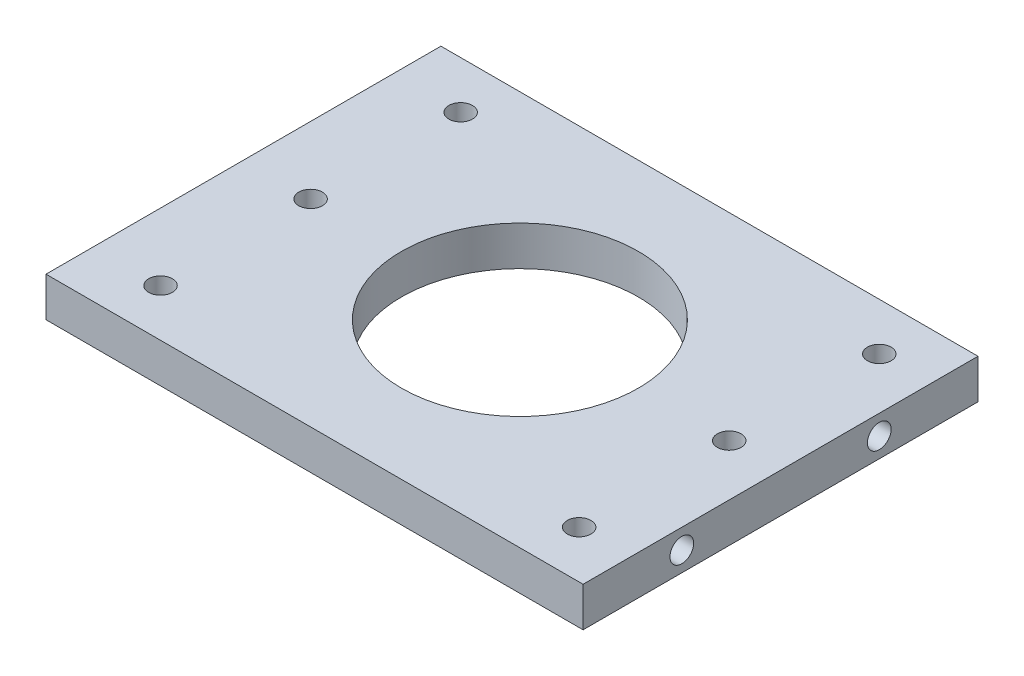
from build123d import *

# Parameters (mm, degrees)
ESQUISSE1_W             = 68
ESQUISSE1_H             = 5
BOSS_EXTRU_1_DEPTH      = 50
ESQUISSE2_R             = 15
ESQUISSE2_R_2           = 1.5
ENL_V_MAT_EXTRU_1_DEPTH = 73.672209269
ESQUISSE3_R             = 1.5
ENL_V_MAT_EXTRU_2_DEPTH = 10
ENL_V_START             = -10
ESQUISSE4_R             = 1.5
ENL_V_MAT_EXTRU_3_DEPTH = 10


with BuildPart() as part:
    # Esquisse1 → Boss.-Extru.1 (new body)
    with BuildSketch(Plane.XY):
        with Locations((18.5, -47.5)):
            Rectangle(ESQUISSE1_W, ESQUISSE1_H)
    extrude(amount=BOSS_EXTRU_1_DEPTH)

    # Esquisse2 → Enlèv. mat.-Extru.1 (cut, through all)
    with BuildSketch(Plane(origin=(0, -45, 0), x_dir=(-1, 0, 0), z_dir=(0, 1, 0))):
        with Locations((-19.5, 25)):
            Circle(ESQUISSE2_R)
        with Locations((-46, 44)):
            Circle(ESQUISSE2_R_2)
        with Locations((-46, 6)):
            Circle(ESQUISSE2_R_2)
        with Locations((7, 44)):
            Circle(ESQUISSE2_R_2)
        with Locations((7, 6)):
            Circle(ESQUISSE2_R_2)
        with Locations((7, 25)):
            Circle(ESQUISSE2_R_2)
        with Locations((-46, 25)):
            Circle(ESQUISSE2_R_2)
    extrude(amount=-ENL_V_MAT_EXTRU_1_DEPTH, mode=Mode.SUBTRACT)

    # Esquisse3 → Enlèv. mat.-Extru.2 (cut)
    with BuildSketch(Plane.ZY.offset(15.5)):
        with Locations((12.5, -47.5)):
            Circle(ESQUISSE3_R)
        with Locations((37.5, -47.5)):
            Circle(ESQUISSE3_R)
    extrude(amount=-ENL_V_MAT_EXTRU_2_DEPTH, mode=Mode.SUBTRACT)

    # Esquisse4 → Enlèv. mat.-Extru.3 (cut)
    with BuildSketch(Plane(origin=(52.5, 0, 0), x_dir=(0, 0, -1), z_dir=(1, 0, 0)).offset(ENL_V_START)):
        with Locations((-37.5, -47.5)):
            Circle(ESQUISSE4_R)
        with Locations((-12.5, -47.5)):
            Circle(ESQUISSE4_R)
    extrude(amount=ENL_V_MAT_EXTRU_3_DEPTH, mode=Mode.SUBTRACT)


solid = part.part
